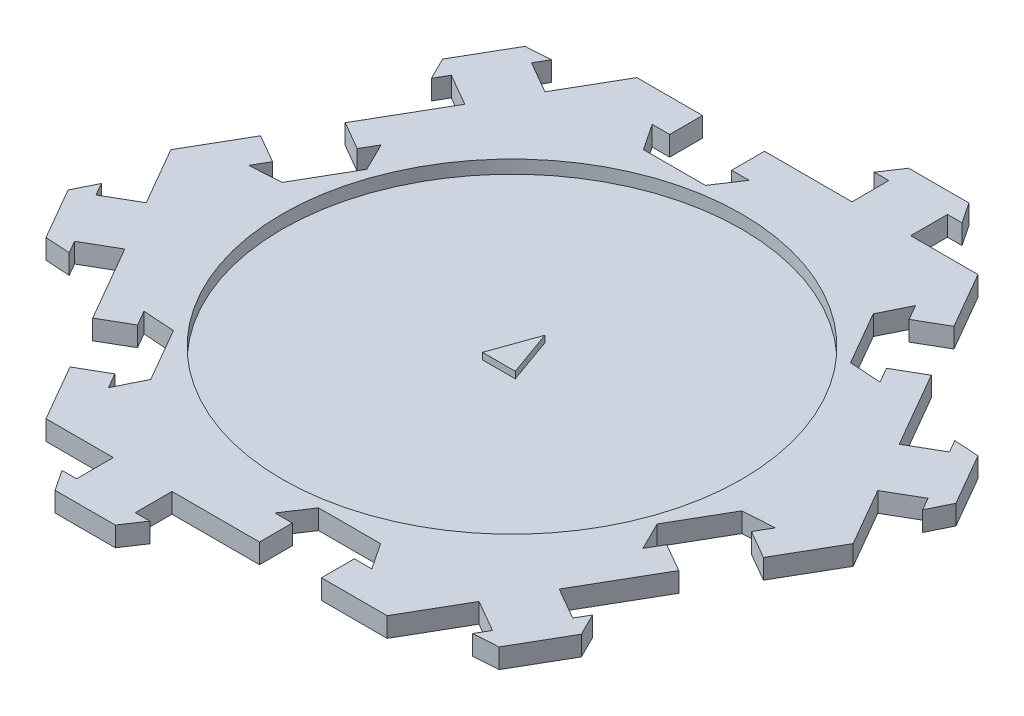
from build123d import *

# Parameters (mm, degrees)
SKETCH1_R           = 35
BOSS_EXTRUDE1_DEPTH = 3
SKETCH1_3_R         = 35
BOSS_EXTRUDE2_DEPTH = 1
BOSS_EXTRUDE3_DEPTH = 2


with BuildPart() as part:
    # Sketch1 → Boss-Extrude1 (new body)
    with BuildSketch(Plane(origin=(0, 0, 0), x_dir=(1, 0, 0), z_dir=(0, 1, 0))):
        Polygon((-15.980762114, 40), (-15.980762114, 45), (-25.980762114, 45), (-31.105762114, 36.123239611), (-35.955504375, 38.923239611), (-34.84856934, 40.840507331), (-38.62542222, 40.598806252), (-43.211790111, 32.654984042), (-41.532682946, 29.263282963), (-40.425747912, 31.180550683), (-35.576005651, 28.380550683), (-42.24128069, 16.835955668), (-37.911153671, 14.335955668), (-36.57925163, 16.642877674), (-34.447052056, 12.335955668), (-39.167295593, 4.160254038), (-43.963299249, 3.853332032), (-42.631397208, 6.160254038), (-46.961524227, 8.660254038), (-51.961524227, 0), (-46.836524227, -8.876760389), (-51.686266488, -11.676760389), (-52.793201523, -9.759492669), (-54.472308687, -13.151193748), (-49.885940796, -21.095015958), (-46.109087917, -21.336717037), (-47.216022951, -19.419449317), (-42.36628069, -16.619449317), (-35.701005651, -28.164044332), (-31.370878632, -25.664044332), (-32.702780673, -23.357122326), (-27.906777016, -23.664044332), (-23.186533479, -31.839745962), (-25.318733054, -36.146667968), (-26.650635095, -33.839745962), (-30.980762114, -36.339745962), (-25.980762114, -45), (-15.730762114, -45), (-15.730762114, -50.6), (-17.944632182, -50.6), (-15.846886468, -53.75), (-6.674150685, -53.75), (-4.576404971, -50.6), (-6.790275039, -50.6), (-6.790275039, -45), (6.540275039, -45), (6.540275039, -40), (3.876470958, -40), (6.540275039, -36), (15.980762114, -36), (18.644566195, -40), (15.980762114, -40), (15.980762114, -45), (25.980762114, -45), (31.105762114, -36.123239611), (35.955504375, -38.923239611), (34.84856934, -40.840507331), (38.62542222, -40.598806252), (43.211790111, -32.654984042), (41.532682946, -29.263282963), (40.425747912, -31.180550683), (35.576005651, -28.380550683), (42.24128069, -16.835955668), (37.911153671, -14.335955668), (36.57925163, -16.642877674), (34.447052056, -12.335955668), (39.167295593, -4.160254038), (43.963299249, -3.853332032), (42.631397208, -6.160254038), (46.961524227, -8.660254038), (51.961524227, 0), (46.836524227, 8.876760389), (51.686266488, 11.676760389), (52.793201523, 9.759492669), (54.472308687, 13.151193748), (49.885940796, 21.095015958), (46.109087917, 21.336717037), (47.216022951, 19.419449317), (42.36628069, 16.619449317), (35.701005651, 28.164044332), (31.370878632, 25.664044332), (32.702780673, 23.357122326), (27.906777016, 23.664044332), (23.186533479, 31.839745962), (25.318733054, 36.146667968), (26.650635095, 33.839745962), (30.980762114, 36.339745962), (25.980762114, 45), (15.730762114, 45), (15.730762114, 50.6), (17.944632182, 50.6), (15.846886468, 53.75), (6.674150685, 53.75), (4.576404971, 50.6), (6.790275039, 50.6), (6.790275039, 45), (-6.540275039, 45), (-6.540275039, 40), (-3.876470958, 40), (-6.540275039, 36), (-15.980762114, 36), (-18.644566195, 40), align=None)
        Circle(SKETCH1_R, mode=Mode.SUBTRACT)
    extrude(amount=BOSS_EXTRUDE1_DEPTH)

    # Sketch1<3> → Boss-Extrude2 (add)
    with BuildSketch(Plane(origin=(0, 0, 0), x_dir=(1, 0, 0), z_dir=(0, 1, 0))):
        Circle(SKETCH1_3_R)
        Polygon((0, 5), (2.5, -2), (-2.5, -2), align=None, mode=Mode.SUBTRACT)
    extrude(amount=BOSS_EXTRUDE2_DEPTH)

    # Sketch1<4> → Boss-Extrude3 (add)
    with BuildSketch(Plane(origin=(0, 0, 0), x_dir=(1, 0, 0), z_dir=(0, 1, 0))):
        Polygon((-2.5, -2), (2.5, -2), (0, 5), align=None)
    extrude(amount=BOSS_EXTRUDE3_DEPTH)


solid = part.part
